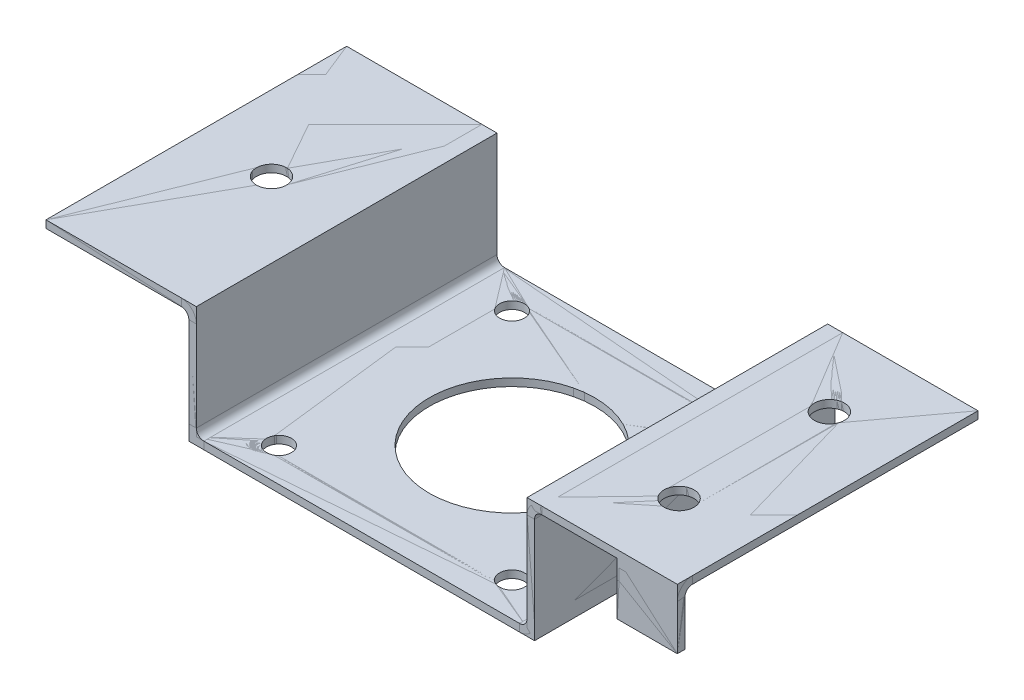
from build123d import *

# Parameters (mm, degrees)
BOSS_EXTRUDE1_DEPTH          = 40
SKETCH2_R                    = 2
CUT_EXTRUDE1_DEPTH           = 95.40338977
SKETCH4_W                    = 8
SKETCH4_H                    = 8
BOSS_EXTRUDE2_DEPTH          = 1
SKETCH5_R                    = 1.65
SKETCH5_R_2                  = 11.01
CUT_EXTRUDE2_DEPTH           = 95.23905772
CONVERT_SOLID1_START         = -14
CONVERT_SOLID1_OUTLINE_W     = 1
CONVERT_SOLID1_OUTLINE_H     = 40
CONVERT_SOLID1_DEPTH         = 12
CONVERT_SOLID1_START_2       = -8
CONVERT_SOLID1_2_OUTLINE_W   = 7.75
CONVERT_SOLID1_2_OUTLINE_H   = 1
CONVERT_SOLID1_2_DEPTH       = 6
CONVERT_SOLID1_3_OUTLINE_W   = 0.25
CONVERT_SOLID1_3_OUTLINE_H   = 1
CONVERT_SOLID1_3_DEPTH       = 4.5
CONVERT_SOLID1_4_OUTLINE_W   = 7.75
CONVERT_SOLID1_4_OUTLINE_H   = 1
CONVERT_SOLID1_4_DEPTH       = 40
CONVERT_SOLID1_5_OUTLINE_W   = 0.5
CONVERT_SOLID1_5_OUTLINE_H   = 1
CONVERT_SOLID1_5_DEPTH       = 36.5
CONVERT_SOLID1_START_3       = 38
CONVERT_SOLID1_6_OUTLINE_W   = 7.75
CONVERT_SOLID1_6_OUTLINE_H   = 1
CONVERT_SOLID1_6_DEPTH       = 2
CONVERT_SOLID1_START_4       = -16
CONVERT_SOLID1_7_OUTLINE_R   = 1.65
CONVERT_SOLID1_7_OUTLINE_R_2 = 11.01
CONVERT_SOLID1_7_OUTLINE_R_3 = 2
CONVERT_SOLID1_7_DEPTH       = 16
CONVERT_SOLID1_START_5       = 76.25
CONVERT_SOLID1_8_DEPTH       = 7.75


with BuildPart() as part:
    # Sketch1 → Boss-Extrude1 (new body)
    with BuildSketch(Plane.XY):
        Polygon((64, 0), (84, 0), (84, -1), (65, -1), (65, -16), (19, -16), (19, -1), (0, -1), (0, 0), (20, 0), (20, -15), (64, -15), align=None)
    extrude(amount=BOSS_EXTRUDE1_DEPTH)

    # Sketch2 → Cut-Extrude1 (cut, through all)
    with BuildSketch(Plane(origin=(0, 0, 0), x_dir=(1, 0, 0), z_dir=(0, 1, 0))):
        with Locations(Location((10, -20, 0), (0, 0, 270))):
            Circle(SKETCH2_R)
        with Locations(Location((74.226162893, -10, 0), (0, 0, 270))):
            Circle(SKETCH2_R)
        with Locations(Location((74.226162893, -30, 0), (0, 0, 270))):
            Circle(SKETCH2_R)
    extrude(amount=-CUT_EXTRUDE1_DEPTH, mode=Mode.SUBTRACT)

    # Sketch4 → Boss-Extrude2 (add)
    with BuildSketch(Plane.XY.offset(40)):
        with Locations((80, -4)):
            Rectangle(SKETCH4_W, SKETCH4_H)
    extrude(amount=-BOSS_EXTRUDE2_DEPTH)

    # Sketch5 → Cut-Extrude2 (cut, through all)
    with BuildSketch(Plane(origin=(0, -15, 0), x_dir=(1, 0, 0), z_dir=(0, 1, 0))):
        with Locations(Location((26.5, -4.5, 0), (0, 0, 270))):
            Circle(SKETCH5_R)
        with Locations(Location((57.5, -4.5, 0), (0, 0, 270))):
            Circle(SKETCH5_R)
        with Locations(Location((26.5, -35.5, 0), (0, 0, 270))):
            Circle(SKETCH5_R)
        with Locations(Location((57.5, -35.5, 0), (0, 0, 270))):
            Circle(SKETCH5_R)
        with Locations(Location((42, -20, 0), (0, 0, 270))):
            Circle(SKETCH5_R_2)
    extrude(amount=-CUT_EXTRUDE2_DEPTH, mode=Mode.SUBTRACT)


with BuildPart() as body_2:
    # Convert-Solid1: read off the stored shape, not the designer's step
    # Convert-Solid1 outline → Convert-Solid1 (new body)
    with BuildSketch(Plane(origin=(0, 0, 0), x_dir=(1, 0, 0), z_dir=(0, 1, 0)).offset(CONVERT_SOLID1_START)):
        with Locations((64.5, -20)):
            Rectangle(CONVERT_SOLID1_OUTLINE_W, CONVERT_SOLID1_OUTLINE_H)
        with Locations((19.5, -20)):
            Rectangle(CONVERT_SOLID1_OUTLINE_W, CONVERT_SOLID1_OUTLINE_H)
    extrude(amount=CONVERT_SOLID1_DEPTH)

    # Convert-Solid1 2 outline → Convert-Solid1 2 (add)
    with BuildSketch(Plane(origin=(0, 0, 0), x_dir=(1, 0, 0), z_dir=(0, 1, 0)).offset(CONVERT_SOLID1_START_2)):
        with Locations((80.125, -39.5)):
            Rectangle(CONVERT_SOLID1_2_OUTLINE_W, CONVERT_SOLID1_2_OUTLINE_H)
    extrude(amount=CONVERT_SOLID1_2_DEPTH)

    # Convert-Solid1 3 outline → Convert-Solid1 3 (add)
    with BuildSketch(Plane(origin=(0, 0, 0), x_dir=(1, 0, 0), z_dir=(0, 1, 0)).offset(CONVERT_SOLID1_START_2)):
        with Locations((76.125, -39.5)):
            Rectangle(CONVERT_SOLID1_3_OUTLINE_W, CONVERT_SOLID1_3_OUTLINE_H)
    extrude(amount=CONVERT_SOLID1_3_DEPTH)

    # Convert-Solid1 4 outline → Convert-Solid1 4 (add)
    with BuildSketch(Plane.XY):
        with Locations((80.125, -0.5)):
            Rectangle(CONVERT_SOLID1_4_OUTLINE_W, CONVERT_SOLID1_4_OUTLINE_H)
        with BuildLine():
            Line((66, -1), (75.75, -1))
            Line((75.75, -1), (75.75, 0))
            Line((75.75, 0), (66, 0))
            ThreePointArc((66, 0), (64.585786438, -0.585786438), (64, -2))
            Line((64, -2), (65, -2))
            ThreePointArc((65, -2), (65.292893219, -1.292893219), (66, -1))
        make_face()
        with BuildLine():
            Line((0, 0), (0, -1))
            Line((0, -1), (18, -1))
            ThreePointArc((18, -1), (18.707106781, -1.292893219), (19, -2))
            Line((19, -2), (20, -2))
            ThreePointArc((20, -2), (19.414213562, -0.585786438), (18, 0))
            Line((18, 0), (0, 0))
        make_face()
        with BuildLine():
            Line((21, -16), (63, -16))
            ThreePointArc((63, -16), (64.414213562, -15.414213562), (65, -14))
            Line((65, -14), (64, -14))
            ThreePointArc((64, -14), (63.707106781, -14.707106781), (63, -15))
            Line((63, -15), (21, -15))
            ThreePointArc((21, -15), (20.292893219, -14.707106781), (20, -14))
            Line((20, -14), (19, -14))
            ThreePointArc((19, -14), (19.585786438, -15.414213562), (21, -16))
        make_face()
    extrude(amount=CONVERT_SOLID1_4_DEPTH)

    # Convert-Solid1 5 outline → Convert-Solid1 5 (add)
    with BuildSketch(Plane.XY):
        with Locations((76, -0.5)):
            Rectangle(CONVERT_SOLID1_5_OUTLINE_W, CONVERT_SOLID1_5_OUTLINE_H)
    extrude(amount=CONVERT_SOLID1_5_DEPTH)

    # Convert-Solid1 6 outline → Convert-Solid1 6 (add)
    with BuildSketch(Plane.XY.offset(CONVERT_SOLID1_START_3)):
        with Locations((80.125, -1.5)):
            Rectangle(CONVERT_SOLID1_6_OUTLINE_W, CONVERT_SOLID1_6_OUTLINE_H)
    extrude(amount=CONVERT_SOLID1_6_DEPTH)

    # Convert-Solid1 7 outline → Convert-Solid1 7 (cut)
    with BuildSketch(Plane(origin=(0, 0, 0), x_dir=(1, 0, 0), z_dir=(0, 1, 0)).offset(CONVERT_SOLID1_START_4)):
        with Locations((26.5, -35.5)):
            Circle(CONVERT_SOLID1_7_OUTLINE_R)
        with Locations((57.5, -35.5)):
            Circle(CONVERT_SOLID1_7_OUTLINE_R)
        with Locations((57.5, -4.5)):
            Circle(CONVERT_SOLID1_7_OUTLINE_R)
        with Locations((26.5, -4.5)):
            Circle(CONVERT_SOLID1_7_OUTLINE_R)
        with Locations((42, -20)):
            Circle(CONVERT_SOLID1_7_OUTLINE_R_2)
        with Locations((10, -20)):
            Circle(CONVERT_SOLID1_7_OUTLINE_R_3)
        with Locations((74.226162893, -30)):
            Circle(CONVERT_SOLID1_7_OUTLINE_R_3)
        with Locations((74.226162893, -10)):
            Circle(CONVERT_SOLID1_7_OUTLINE_R_3)
    extrude(amount=CONVERT_SOLID1_7_DEPTH, mode=Mode.SUBTRACT)

    # Convert-Solid1 8 outline → Convert-Solid1 8 (cut)
    with BuildSketch(Plane.YZ.offset(CONVERT_SOLID1_START_5)):
        with BuildLine():
            ThreePointArc((-2, 40), (-0.585786438, 39.414213562), (0, 38))
            Line((0, 38), (0, 40))
            Line((0, 40), (-2, 40))
        make_face()
        with BuildLine():
            ThreePointArc((-1, 38), (-1.292893219, 38.707106781), (-2, 39))
            Line((-2, 39), (-2, 38))
            Line((-2, 38), (-1, 38))
        make_face()
    extrude(amount=CONVERT_SOLID1_8_DEPTH, mode=Mode.SUBTRACT)


solid = Compound([part.part, body_2.part])
